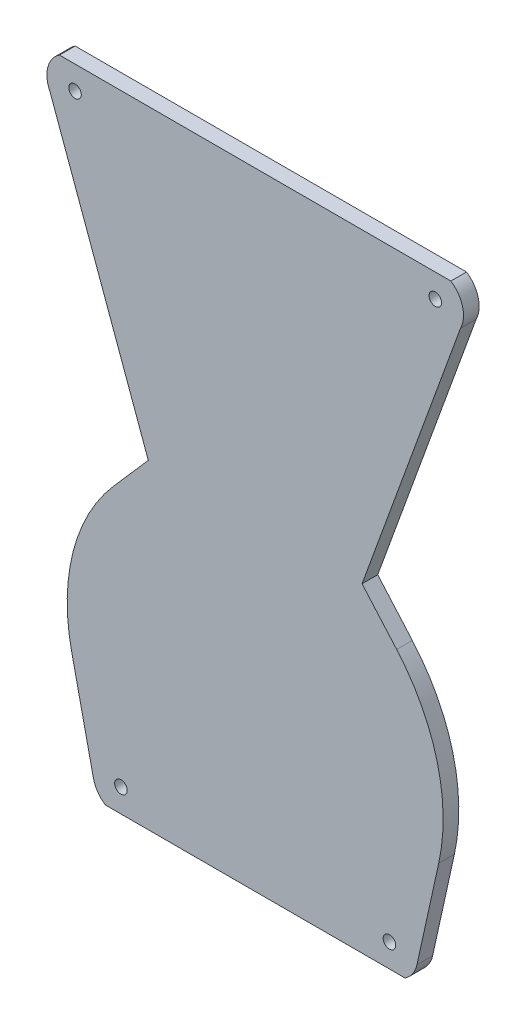
from build123d import *

# Parameters (mm, degrees)
SKETCH1_R           = 2
BOSS_EXTRUDE1_DEPTH = 5
BOSS_EXTRUDE2_DEPTH = 10
CHAMFER2_SIZE       = 10


with BuildPart() as part:
    # Sketch1 → Boss-Extrude1 (new body)
    with BuildSketch(Plane.XY):
        with BuildLine():
            ThreePointArc((58.593094964, -62.917012913), (58.124418815, -35.115379165), (45.172708428, -10.510426525))
            Line((45.172708428, -10.510426525), (34.120235365, 2.132661237))
            Line((34.120235365, 2.132661237), (65.536970349, 88.4494312))
            ThreePointArc((65.536970349, 88.4494312), (66.199502533, 94.806221081), (62.474937186, 100))
            Line((62.474937186, 100), (55, 100))
            Line((55, 100), (-55, 100))
            Line((-55, 100), (-62.474937186, 100))
            ThreePointArc((-62.474937186, 100), (-66.199502533, 94.806221081), (-65.536970349, 88.4494312))
            Line((-65.536970349, 88.4494312), (-34.120235365, 2.132661237))
            Line((-34.120235365, 2.132661237), (-45.172708428, -10.510426525))
            ThreePointArc((-45.172708428, -10.510426525), (-58.124418815, -35.115379165), (-58.593094964, -62.917012913))
            Line((-58.593094964, -62.917012913), (-51.644303304, -94.437551937))
            ThreePointArc((-51.644303304, -94.437551937), (-50.278037542, -97.589552755), (-47.830276245, -100))
            Line((-47.830276245, -100), (-40.355339059, -100))
            Line((-40.355339059, -100), (40.355339059, -100))
            Line((40.355339059, -100), (47.830276245, -100))
            ThreePointArc((47.830276245, -100), (50.278037542, -97.589552755), (51.644303304, -94.437551937))
            Line((51.644303304, -94.437551937), (58.593094964, -62.917012913))
        make_face()
        with Locations((-42.855339059, -92.5)):
            Circle(SKETCH1_R, mode=Mode.SUBTRACT)
        with Locations((42.855339059, -92.5)):
            Circle(SKETCH1_R, mode=Mode.SUBTRACT)
        with Locations((-57.5, 92.5)):
            Circle(SKETCH1_R, mode=Mode.SUBTRACT)
        with Locations((57.5, 92.5)):
            Circle(SKETCH1_R, mode=Mode.SUBTRACT)
    extrude(amount=BOSS_EXTRUDE1_DEPTH)

    # Sketch2 → Boss-Extrude2 (add)
    with BuildSketch(Plane(origin=(0, 0, 0), x_dir=(-1, 0, 0), z_dir=(0, 0, -1))):
        with BuildLine():
            Line((-25.870507592, 10.166666667), (-24.253462846, 5.723872742))
            ThreePointArc((-24.253462846, 5.723872742), (-23.669056818, 3.144030102), (-23.747944524, 0.5))
            Line((-23.747944524, 0.5), (23.747944524, 0.5))
            ThreePointArc((23.747944524, 0.5), (23.669056818, 3.144030102), (24.253462846, 5.723872742))
            Line((24.253462846, 5.723872742), (25.870507592, 10.166666667))
            Line((25.870507592, 10.166666667), (-25.870507592, 10.166666667))
        make_face()
    extrude(amount=BOSS_EXTRUDE2_DEPTH)

    # Chamfer2
    # the kernel refuses this chamfer: 10 mm, written as the material it takes off along each edge
    with BuildSketch(Plane(origin=(-51.587337472, 10.166666667, -10), x_dir=(0, 0.027495876610586317, 0.9996219169112968), z_dir=(1, 0, 0))) as chamfer2_piece_1_section:
        Polygon((CHAMFER2_SIZE * 0.999621916911, CHAMFER2_SIZE * 0.0274958766106), (-CHAMFER2_SIZE * 0.0274958766106, CHAMFER2_SIZE * 0.999621916911), (0, 0), align=None)
    chamfer2_piece_1 = extrude(amount=103.174674944, mode=Mode.PRIVATE)
    chamfer2_piece_1 = split(chamfer2_piece_1, bisect_by=Plane(origin=(0, 6.862625123, 0), z_dir=(0, 0, -1)), keep=Keep.TOP, mode=Mode.PRIVATE)
    add(chamfer2_piece_1, mode=Mode.SUBTRACT)


solid = part.part
